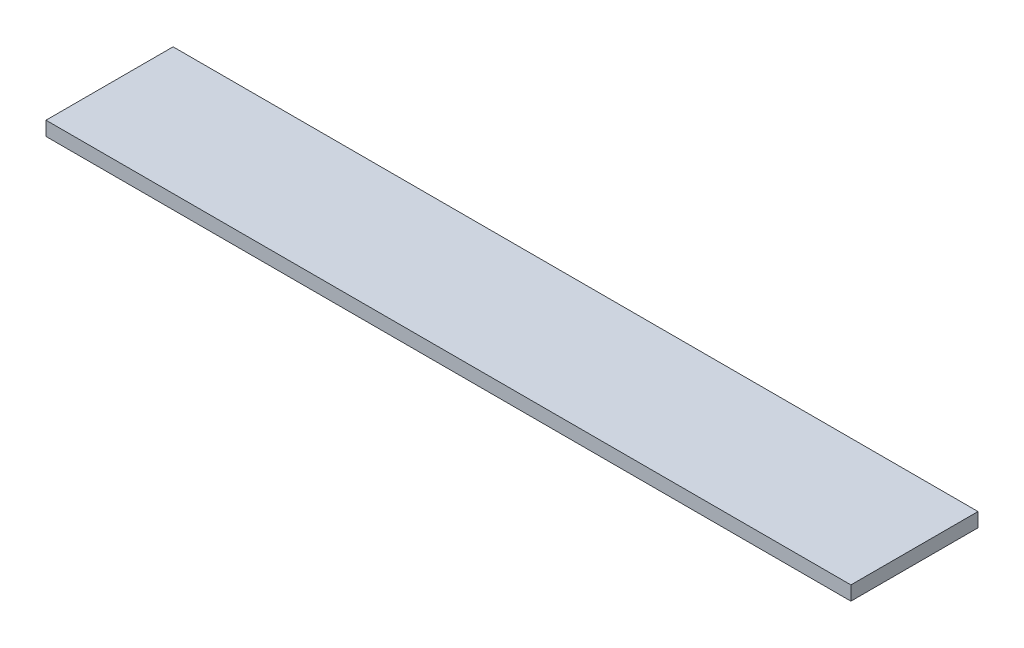
from build123d import *

# Parameters (mm, degrees)
SKETCH1_W           = 228
SKETCH1_H           = 36
BOSS_EXTRUDE2_DEPTH = 4


with BuildPart() as part:
    # Sketch1 → Boss-Extrude2 (new body)
    with BuildSketch(Plane(origin=(0, 0, 0), x_dir=(1, 0, 0), z_dir=(0, 1, 0))):
        with Locations((114, 18)):
            Rectangle(SKETCH1_W, SKETCH1_H)
    extrude(amount=BOSS_EXTRUDE2_DEPTH)


solid = part.part
